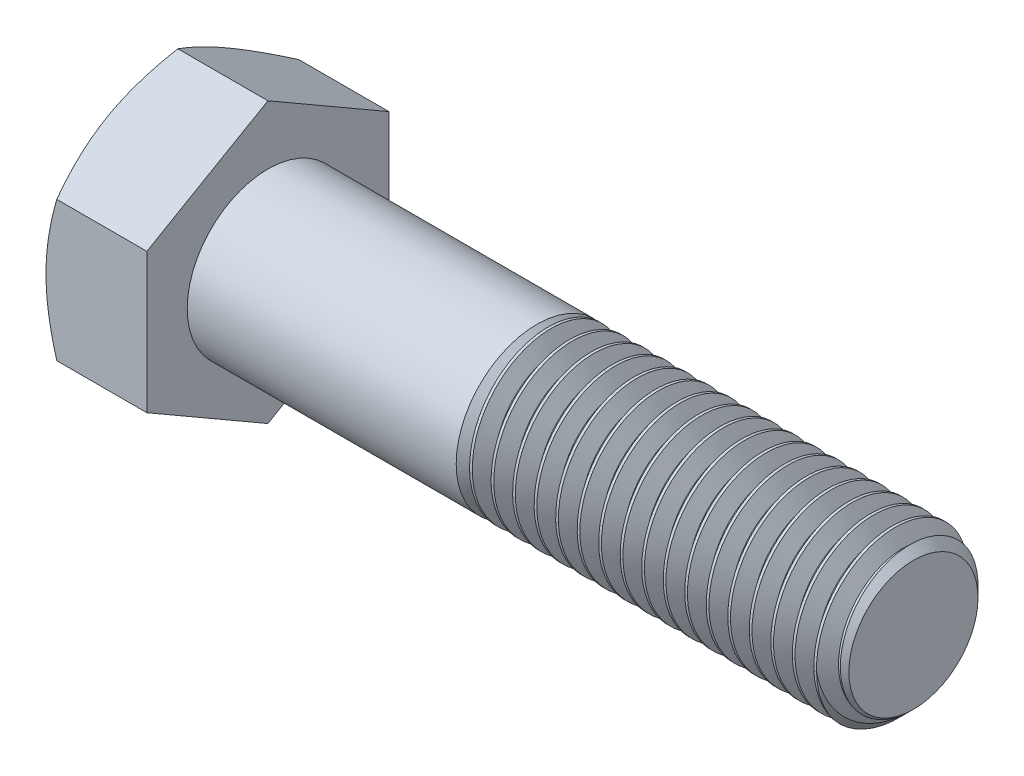
from build123d import *

# Parameters (mm, degrees)
SKETCH5_R           = 9.525
BOSS_EXTRUDE3_DEPTH = 76.2
CHAMFER1_SIZE       = 1.905
CUT_SWEEP1_PITCH    = 2.54
BOSS_EXTRUDE4_DEPTH = 11.90625
SKETCH8_OUTSIDE_W   = 368.138
SKETCH8_OUTSIDE_H   = 372.558
SKETCH8_OUTSIDE_R   = 14.2875
CUT_EXTRUDE3_DEPTH  = 91.769052204
CUT_EXTRUDE3_DRAFT  = -60


with BuildPart() as part:
    # Sketch5 → Boss-Extrude3 (new body)
    with BuildSketch(Plane(origin=(44.053125, 0, 0), x_dir=(0, 0, -1), z_dir=(1, 0, 0))):
        Circle(SKETCH5_R)
    extrude(amount=-BOSS_EXTRUDE3_DEPTH)

    # Chamfer1
    chamfer1_edges = [part.edges().sort_by_distance(p)[0] for p in [
        (44.053125, 0, 9.525),
    ]]
    chamfer(chamfer1_edges, length=CHAMFER1_SIZE)

    # Cut-Sweep1: the profile of Sketch10 profile screwed along a right-hand helix of 18.5 turns, 10 arcs to a turn; built about Z, then put on its axis
    cut_sweep1_z = Axis((0, 0, 0), (0, 0, 1))
    cut_sweep1_corners = [(9.5253, 0, 0.000173205), (7.875221606, 0, -0.9525), (7.875221606, 0, -1.27), (9.5253, 0, -2.222673205)]
    with BuildLine(mode=Mode.PRIVATE) as cut_sweep1_profile:
        Line(cut_sweep1_corners[0], cut_sweep1_corners[1])
        Line(cut_sweep1_corners[1], cut_sweep1_corners[2])
        Line(cut_sweep1_corners[2], cut_sweep1_corners[3])
        Line(cut_sweep1_corners[3], cut_sweep1_corners[0])
    cut_sweep1_cap = Face(cut_sweep1_profile.wire())
    cut_sweep1_turn_angles = [0, 18, 36, 54, 72, 90, 108, 126, 144, 162, 180, 198, 216, 234, 252, 270, 288, 306, 324, 342, 360]
    cut_sweep1_turn_weights = [1, 0.9510565162951535, 1, 0.9510565162951535, 1, 0.9510565162951535, 1, 0.9510565162951535, 1, 0.9510565162951535, 1, 0.9510565162951535, 1, 0.9510565162951535, 1, 0.9510565162951535, 1, 0.9510565162951535, 1, 0.9510565162951535, 1]
    cut_sweep1_turn_rails = [Edge.make_bspline([Vector(p[0], p[1], 0).rotate(cut_sweep1_z, cut_sweep1_turn_angles[k]) / cut_sweep1_turn_weights[k] + Vector(0, 0, p[2] + CUT_SWEEP1_PITCH * cut_sweep1_turn_angles[k] / 360) for k in range(21)], [0, 0, 0, 1, 1, 2, 2, 3, 3, 4, 4, 5, 5, 6, 6, 7, 7, 8, 8, 9, 9, 10, 10, 10], 2, cut_sweep1_turn_weights) for p in cut_sweep1_corners]
    cut_sweep1_turn_sides = [Face.make_surface_from_curves(cut_sweep1_turn_rails[p[0]], cut_sweep1_turn_rails[p[1]]) for p in [(0, 1), (1, 2), (2, 3), (3, 0)]]
    cut_sweep1_last_angles = [6480, 6498, 6516, 6534, 6552, 6570, 6588, 6606, 6624, 6642, 6660]
    cut_sweep1_last_weights = [1, 0.9510565162951535, 1, 0.9510565162951535, 1, 0.9510565162951535, 1, 0.9510565162951535, 1, 0.9510565162951192, 1]
    cut_sweep1_last_rails = [Edge.make_bspline([Vector(p[0], p[1], 0).rotate(cut_sweep1_z, cut_sweep1_last_angles[k]) / cut_sweep1_last_weights[k] + Vector(0, 0, p[2] + CUT_SWEEP1_PITCH * cut_sweep1_last_angles[k] / 360) for k in range(11)], [0, 0, 0, 1, 1, 2, 2, 3, 3, 4, 4, 5, 5, 5], 2, cut_sweep1_last_weights) for p in cut_sweep1_corners]
    cut_sweep1_last_sides = [Face.make_surface_from_curves(cut_sweep1_last_rails[p[0]], cut_sweep1_last_rails[p[1]]) for p in [(0, 1), (1, 2), (2, 3), (3, 0)]]
    cut_sweep1 = Plane(origin=(44.053125, 0, 0), x_dir=(0, 1, 0), z_dir=(-1, 0, 0)) * Solid(Shell([*[p.moved(Location((0, 0, CUT_SWEEP1_PITCH * i))) for i in range(18) for p in cut_sweep1_turn_sides], *cut_sweep1_last_sides, cut_sweep1_cap, cut_sweep1_cap.rotate(cut_sweep1_z, 6660).moved(Location((0, 0, CUT_SWEEP1_PITCH * 6660 / 360)))]))
    add(cut_sweep1, mode=Mode.SUBTRACT)

    # Sketch11 → Revolve1 (revolve)
    with BuildSketch(Plane.XY, mode=Mode.PRIVATE) as revolve1_sk:
        Polygon((-32.146875, 9.525), (-32.146875, 0), (9.128125, 0), (-0.396875, 9.525), align=None)
    revolve(revolve1_sk.sketch.rotate(Axis((-32.146875, 0, 0), (1, 0, 0)), 270), axis=Axis((-32.146875, 0, 0), (1, 0, 0)))

    # Sketch6 → Boss-Extrude4 (add)
    with BuildSketch(Plane.ZY.offset(32.146875)):
        Polygon((14.2875, 8.248891971), (0, 16.497783942), (-14.2875, 8.248891971), (-14.2875, -8.248891971), (0, -16.497783942), (14.2875, -8.248891971), align=None)
    extrude(amount=BOSS_EXTRUDE4_DEPTH)


with BuildPart() as cut_extrude3_tool:
    # Sketch8 outside → Cut-Extrude3 (with draft: the straight prism first)
    with BuildSketch(Plane.ZY.offset(44.053125)):
        Rectangle(SKETCH8_OUTSIDE_W, SKETCH8_OUTSIDE_H)
        Circle(SKETCH8_OUTSIDE_R, mode=Mode.SUBTRACT)
    extrude(amount=-CUT_EXTRUDE3_DEPTH)
    # Cut-Extrude3: the draft: its side faces are tilted about the plane it starts from
    cut_extrude3_sides = [cut_extrude3_tool.faces().sort_by_distance(p)[0] for p in [
        (1.831401102, -186.279, 0),
        (1.831401102, 0, 184.069),
        (1.831401102, 186.279, 0),
        (1.831401102, 0, -184.069),
        (1.831401102, 0, -14.2875),
    ]]
    draft(cut_extrude3_sides, Plane.ZY.offset(44.053125), CUT_EXTRUDE3_DRAFT)


with BuildPart() as part_1:
    add(part.part)

    # Cut-Extrude3: cut by cut_extrude3_tool
    add(cut_extrude3_tool.part, mode=Mode.SUBTRACT)


solid = part_1.part
